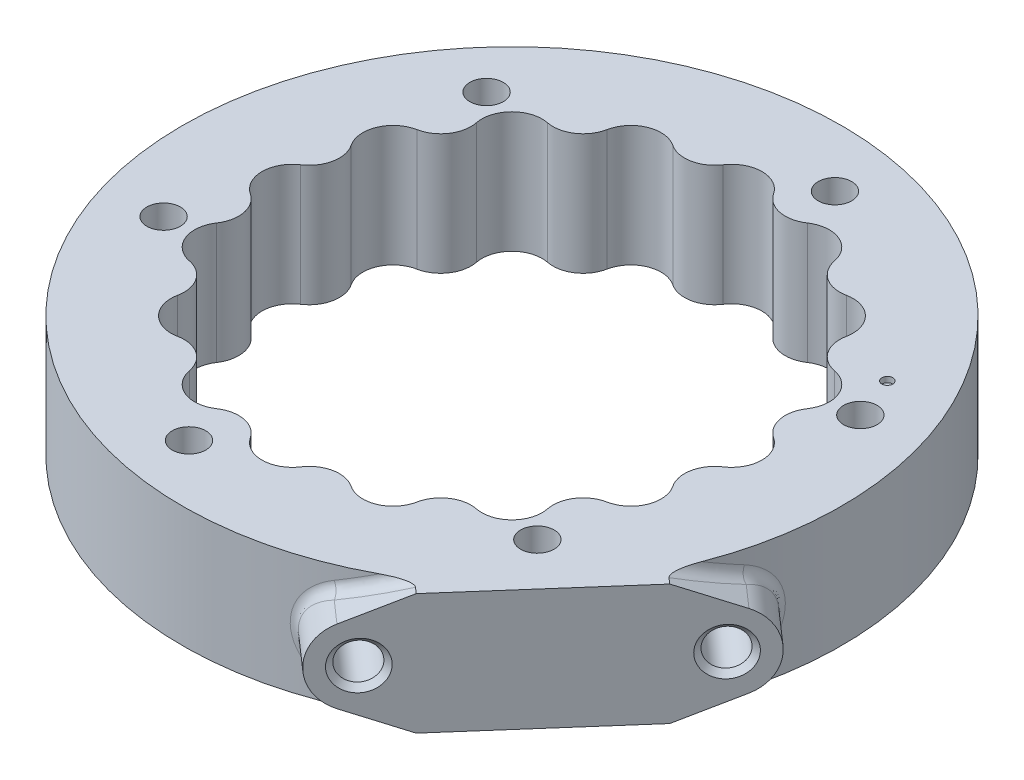
from build123d import *

# Parameters (mm, degrees)
SKETCH1_R                = 60
BOSS_EXTRUDE1_DEPTH      = 22
FILLET1_R                = 5
FILLET2_R                = 6
SKETCH3_R                = 3.05
CUT_EXTRUDE1_DEPTH       = 88.658428165
BOSS_EXTRUDE3_REACH      = 149.334
BOSS_EXTRUDE3_END_RADIUS = 60
SKETCH7_R                = 3.3
CUT_EXTRUDE3_DEPTH       = 10.5
CHAMFER2_SIZE            = 1
FILLET3_R                = 2
SKETCH8_W                = 32.70355213
SKETCH8_H                = 5.5
CUT_EXTRUDE4_DEPTH       = 149.347998989
SKETCH10_R               = 1
CUT_EXTRUDE6_DEPTH       = 1
CUT_EXTRUDE7_DEPTH       = 95.422690578


with BuildPart() as part:
    # Sketch1 → Boss-Extrude1 (new body)
    with BuildSketch(Plane(origin=(0, 0, 0), x_dir=(1, 0, 0), z_dir=(0, 1, 0))):
        with Locations(Location((0, 0, 0), (0, 0, 270))):
            Circle(SKETCH1_R)
        with BuildLine():
            ThreePointArc((-31.591922188, 24.534678569), (-33.258784492, 22.222809321), (-34.756792584, 19.798115295))
            ThreePointArc((-34.756792584, 19.798115295), (-41.574578963, 17.220754456), (-38.576145309, 10.577382149))
            ThreePointArc((-38.576145309, 10.577382149), (-39.231411216, 7.803612881), (-39.6875, 4.99022482))
            ThreePointArc((-39.6875, 4.99022482), (-45, 0), (-39.6875, -4.99022482))
            ThreePointArc((-39.6875, -4.99022482), (-39.231411216, -7.803612881), (-38.576145309, -10.577382149))
            ThreePointArc((-38.576145309, -10.577382149), (-41.574578963, -17.220754456), (-34.756792584, -19.798115295))
            ThreePointArc((-34.756792584, -19.798115295), (-33.258784492, -22.222809321), (-31.591922188, -24.534678569))
            ThreePointArc((-31.591922188, -24.534678569), (-31.819805153, -31.819805153), (-24.534678569, -31.591922188))
            ThreePointArc((-24.534678569, -31.591922188), (-22.222809321, -33.258784492), (-19.798115295, -34.756792584))
            ThreePointArc((-19.798115295, -34.756792584), (-17.220754456, -41.574578963), (-10.577382149, -38.576145309))
            ThreePointArc((-10.577382149, -38.576145309), (-7.803612881, -39.231411216), (-4.99022482, -39.6875))
            ThreePointArc((-4.99022482, -39.6875), (0, -45), (4.99022482, -39.6875))
            ThreePointArc((4.99022482, -39.6875), (7.803612881, -39.231411216), (10.577382149, -38.576145309))
            ThreePointArc((10.577382149, -38.576145309), (17.220754456, -41.574578963), (19.798115295, -34.756792584))
            ThreePointArc((19.798115295, -34.756792584), (22.222809321, -33.258784492), (24.534678569, -31.591922188))
            ThreePointArc((24.534678569, -31.591922188), (31.819805153, -31.819805153), (31.591922188, -24.534678569))
            ThreePointArc((31.591922188, -24.534678569), (33.258784492, -22.222809321), (34.756792584, -19.798115295))
            ThreePointArc((34.756792584, -19.798115295), (41.574578963, -17.220754456), (38.576145309, -10.577382149))
            ThreePointArc((38.576145309, -10.577382149), (39.231411216, -7.803612881), (39.6875, -4.99022482))
            ThreePointArc((39.6875, -4.99022482), (45, 0), (39.6875, 4.99022482))
            ThreePointArc((39.6875, 4.99022482), (39.231411216, 7.803612881), (38.576145309, 10.577382149))
            ThreePointArc((38.576145309, 10.577382149), (41.574578963, 17.220754456), (34.756792584, 19.798115295))
            ThreePointArc((34.756792584, 19.798115295), (33.258784492, 22.222809321), (31.591922188, 24.534678569))
            ThreePointArc((31.591922188, 24.534678569), (31.819805153, 31.819805153), (24.534678569, 31.591922188))
            ThreePointArc((24.534678569, 31.591922188), (22.222809321, 33.258784492), (19.798115295, 34.756792584))
            ThreePointArc((19.798115295, 34.756792584), (17.220754456, 41.574578963), (10.577382149, 38.576145309))
            ThreePointArc((10.577382149, 38.576145309), (7.803612881, 39.231411216), (4.99022482, 39.6875))
            ThreePointArc((4.99022482, 39.6875), (0, 45), (-4.99022482, 39.6875))
            ThreePointArc((-4.99022482, 39.6875), (-7.803612881, 39.231411216), (-10.577382149, 38.576145309))
            ThreePointArc((-10.577382149, 38.576145309), (-17.220754456, 41.574578963), (-19.798115295, 34.756792584))
            ThreePointArc((-19.798115295, 34.756792584), (-22.222809321, 33.258784492), (-24.534678569, 31.591922188))
            ThreePointArc((-24.534678569, 31.591922188), (-31.819805153, 31.819805153), (-31.591922188, 24.534678569))
        make_face(mode=Mode.SUBTRACT)
    extrude(amount=BOSS_EXTRUDE1_DEPTH)

    # Fillet1
    # the kernel refuses this fillet: 5 mm, written as the material it takes off along each edge
    with BuildSketch(Plane(origin=(-31.591922188, -7.937782114, -24.534678569), x_dir=(-0.5708127348451637, 0, -0.8210802772802334), z_dir=(0, 1, 0))) as fillet1_piece_1:
        with BuildLine():
            CenterArc((3.572001951, 4.856162203), FILLET1_R, 201.908932705, 54.314665287)
            ThreePointArc((-1.066888508, 2.990500041), (-0.503760138, 1.505840103), (0, 0))
            ThreePointArc((0, 0), (1.190667317, 0.143837797), (2.381334634, 0))
        make_face()
    extrude(amount=37.875564228, mode=Mode.SUBTRACT)
    with BuildSketch(Plane(origin=(-34.756792584, -7.937782114, -19.798115295), x_dir=(-0.977019839336146, 0, -0.21314838386338178), z_dir=(0, 1, 0)), Plane(origin=(10.577382149, -7.937782114, 38.576145309), x_dir=(0.5401386861196337, 0, 0.8415760213771278), z_dir=(0, 1, 0)), Plane(origin=(-4.99022482, -7.937782114, 39.6875), x_dir=(0.176965876366712, 0, 0.984216987560041), z_dir=(0, 1, 0)), Plane(origin=(-19.798115295, -7.937782114, 34.756792584), x_dir=(-0.21314838386337953, 0, 0.9770198393361466), z_dir=(0, 1, 0)), Plane(origin=(-31.591922188, -7.937782114, 24.534678569), x_dir=(-0.5708127348451787, 0, 0.8210802772802229), z_dir=(0, 1, 0)), Plane(origin=(-38.576145309, -7.937782114, 10.577382149), x_dir=(-0.84157602137713, 0, 0.5401386861196305), z_dir=(0, 1, 0)), Plane(origin=(-39.6875, -7.937782114, -4.99022482), x_dir=(-0.9842169875600411, 0, 0.17696587636671054), z_dir=(0, 1, 0)), Plane(origin=(24.534678569, -7.937782114, 31.591922188), x_dir=(0.8210802772802258, 0, 0.5708127348451744), z_dir=(0, 1, 0)), Plane(origin=(34.756792584, -7.937782114, 19.798115295), x_dir=(0.9770198393361469, 0, 0.2131483838633775), z_dir=(0, 1, 0)), Plane(origin=(39.6875, -7.937782114, 4.99022482), x_dir=(0.9842169875600401, 0, -0.1769658763667165), z_dir=(0, 1, 0)), Plane(origin=(38.576145309, -7.937782114, -10.577382149), x_dir=(0.8415760213771245, 0, -0.5401386861196388), z_dir=(0, 1, 0)), Plane(origin=(31.591922188, -7.937782114, -24.534678569), x_dir=(0.5708127348451758, 0, -0.8210802772802248), z_dir=(0, 1, 0)), Plane(origin=(19.798115295, -7.937782114, -34.756792584), x_dir=(0.21314838386337198, 0, -0.9770198393361482), z_dir=(0, 1, 0)), Plane(origin=(4.99022482, -7.937782114, -39.6875), x_dir=(-0.17696587636672031, 0, -0.9842169875600394), z_dir=(0, 1, 0)), Plane(origin=(-10.577382149, -7.937782114, -38.576145309), x_dir=(-0.5401386861196261, 0, -0.8415760213771326), z_dir=(0, 1, 0)), Plane(origin=(-24.534678569, -7.937782114, -31.591922188), x_dir=(-0.82108027728022, 0, -0.5708127348451829), z_dir=(0, 1, 0))) as fillet1_piece_2:
        with BuildLine():
            CenterArc((3.572001951, -4.856162203), FILLET1_R, 103.776402008, 54.314665287)
            ThreePointArc((-1.066888508, -2.990500041), (-0.503760138, -1.505840103), (0, 0))
            ThreePointArc((0, 0), (1.190667317, -0.143837797), (2.381334634, 0))
        make_face()
    extrude(amount=37.875564228, mode=Mode.SUBTRACT)
    with BuildSketch(Plane(origin=(4.99022482, -7.937782114, 39.6875), x_dir=(0.9864543257067245, 0, -0.1640361645933343), z_dir=(0, 1, 0)), Plane(origin=(-10.577382149, -7.937782114, 38.576145309), x_dir=(0.9741388837762464, 0, 0.22595007217340898), z_dir=(0, 1, 0)), Plane(origin=(-24.534678569, -7.937782114, 31.591922188), x_dir=(0.8135196273818055, 0, 0.5815374586942516), z_dir=(0, 1, 0)), Plane(origin=(-34.756792584, -7.937782114, 19.798115295), x_dir=(0.5290493822922732, 0, 0.8485910387790836), z_dir=(0, 1, 0)), Plane(origin=(-39.6875, -7.937782114, 4.99022482), x_dir=(0.1640361645933272, 0, 0.9864543257067256), z_dir=(0, 1, 0)), Plane(origin=(-38.576145309, -7.937782114, -10.577382149), x_dir=(-0.22595007217340937, 0, 0.9741388837762464), z_dir=(0, 1, 0)), Plane(origin=(19.798115295, -7.937782114, 34.756792584), x_dir=(0.8485910387790846, 0, -0.5290493822922715), z_dir=(0, 1, 0)), Plane(origin=(31.591922188, -7.937782114, 24.534678569), x_dir=(0.5815374586942491, 0, -0.8135196273818073), z_dir=(0, 1, 0)), Plane(origin=(38.576145309, -7.937782114, 10.577382149), x_dir=(0.22595007217340277, 0, -0.9741388837762479), z_dir=(0, 1, 0)), Plane(origin=(39.6875, -7.937782114, -4.99022482), x_dir=(-0.16403616459333684, 0, -0.9864543257067241), z_dir=(0, 1, 0)), Plane(origin=(34.756792584, -7.937782114, -19.798115295), x_dir=(-0.5290493822922758, 0, -0.8485910387790819), z_dir=(0, 1, 0)), Plane(origin=(24.534678569, -7.937782114, -31.591922188), x_dir=(-0.8135196273818096, 0, -0.5815374586942458), z_dir=(0, 1, 0)), Plane(origin=(10.577382149, -7.937782114, -38.576145309), x_dir=(-0.9741388837762485, 0, -0.22595007217340046), z_dir=(0, 1, 0)), Plane(origin=(-4.99022482, -7.937782114, -39.6875), x_dir=(-0.9864543257067236, 0, 0.16403616459333964), z_dir=(0, 1, 0)), Plane(origin=(-19.798115295, -7.937782114, -34.756792584), x_dir=(-0.8485910387790874, 0, 0.5290493822922673), z_dir=(0, 1, 0))) as fillet1_piece_3:
        with BuildLine():
            CenterArc((3.373557398, -4.996060424), FILLET1_R, 92.274604499, 54.314665287)
            ThreePointArc((-0.800166381, -2.24287503), (-0.264608655, -1.169769307), (0, 0))
            ThreePointArc((0, 0), (1.587556423, -0.031516609), (3.175112846, 0))
        make_face()
    extrude(amount=37.875564228, mode=Mode.SUBTRACT)

    # Fillet2
    fillet2_edges = [part.edges().sort_by_distance(p)[0] for p in [
        (-7.805937782, 11, 39.243099283),
        (7.805937782, 11, 39.243099283),
        (22.229430079, 11, 33.268693157),
        (33.268693157, 11, 22.229430079),
        (-22.229430079, 11, 33.268693157),
        (-33.268693157, 11, 22.229430079),
        (-39.243099283, 11, 7.805937782),
        (-39.243099283, 11, -7.805937782),
        (39.243099283, 11, 7.805937782),
        (39.243099283, 11, -7.805937782),
        (33.268693157, 11, -22.229430079),
        (22.229430079, 11, -33.268693157),
        (7.805937782, 11, -39.243099283),
        (-7.805937782, 11, -39.243099283),
        (-22.229430079, 11, -33.268693157),
        (-33.268693157, 11, -22.229430079),
    ]]
    fillet(fillet2_edges, radius=FILLET2_R)

    # Sketch3 → Cut-Extrude1 (cut, through all)
    with BuildSketch(Plane(origin=(0, 22, 0), x_dir=(1, 0, 0), z_dir=(0, 1, 0))):
        with Locations(Location((9.754516101, 49.03926402, 0), (0, 0, 270))):
            Circle(SKETCH3_R)
        with Locations(Location((47.346506475, 16.071973265, 0), (0, 0, 270))):
            Circle(SKETCH3_R)
        with Locations(Location((37.591990374, -32.967290755, 0), (0, 0, 270))):
            Circle(SKETCH3_R)
        with Locations(Location((-9.754516101, -49.03926402, 0), (0, 0, 270))):
            Circle(SKETCH3_R)
        with Locations(Location((-47.346506475, -16.071973265, 0), (0, 0, 270))):
            Circle(SKETCH3_R)
        with Locations(Location((-37.591990374, 32.967290755, 0), (0, 0, 270))):
            Circle(SKETCH3_R)
    extrude(amount=-CUT_EXTRUDE1_DEPTH, mode=Mode.SUBTRACT)

    # Boss-Extrude3: up to this cylinder (the profile starts outside it)
    boss_extrude3_end = Plane(origin=(0, 11, 0), z_dir=(0, -1, 0)) * Cylinder(BOSS_EXTRUDE3_END_RADIUS, 419.668, mode=Mode.PRIVATE)
    # Sketch6 → Boss-Extrude3 (add, up to the surface)
    with BuildSketch(Plane(origin=(48.322940338, 0, 37.41419036), x_dir=(-0.6593458151000848, 0, 0.7518398074789634), z_dir=(-0.7518398074789634, 0, -0.6593458151000848)), mode=Mode.PRIVATE) as boss_extrude3_sk1:
        with BuildLine():
            Line((-22.841633403, 17.677522556), (-2.694264982, 26.197120299))
            ThreePointArc((-2.694264982, 26.197120299), (3.732050808, 27.5), (10.158366597, 26.197120299))
            Line((10.158366597, 26.197120299), (30.305735018, 17.677522556))
            ThreePointArc((30.305735018, 17.677522556), (34.732050808, 11), (30.305735018, 4.322477444))
            Line((30.305735018, 4.322477444), (10.158366597, -4.197120299))
            ThreePointArc((10.158366597, -4.197120299), (3.732050808, -5.5), (-2.694264982, -4.197120299))
            Line((-2.694264982, -4.197120299), (-22.841633403, 4.322477444))
            ThreePointArc((-22.841633403, 4.322477444), (-27.267949192, 11), (-22.841633403, 17.677522556))
        make_face()
    boss_extrude3_tool1 = extrude(boss_extrude3_sk1.sketch, amount=BOSS_EXTRUDE3_REACH, mode=Mode.PRIVATE) - boss_extrude3_end
    add(boss_extrude3_tool1.solids().sort_by_distance((45.862228, 11, 40.220095))[0])

    # Sketch7 → Cut-Extrude3 (cut)
    with BuildSketch(Plane(origin=(45.862228256, 0, 40.220094721), x_dir=(0.6593458151000849, 0, -0.7518398074789633), z_dir=(0.7518398074789633, 0, 0.6593458151000849))):
        with Locations((23.75, 11)):
            Circle(SKETCH7_R)
        with Locations((-23.75, 11)):
            Circle(SKETCH7_R)
    extrude(amount=-CUT_EXTRUDE3_DEPTH, mode=Mode.SUBTRACT)

    # Chamfer2
    chamfer2_edges = [part.edges().sort_by_distance(p)[0] for p in [
        (59.345850175, 11, 24.844970658),
        (28.026923958, 11, 60.557361513),
    ]]
    chamfer(chamfer2_edges, length=CHAMFER2_SIZE)

    # Fillet3
    fillet3_edges = [part.edges().sort_by_distance(p)[0] for p in [
        (56.305748885, 19.805835114, 20.728305345),
        (27.900346821, 2.194164886, 53.11845863),
        (59.062632001, 11, 10.564350485),
        (56.305748885, 2.194164886, 20.728305345),
        (18.18319146, 11, 57.178418554),
        (27.900346821, 19.805835114, 53.11845863),
    ]]
    fillet(fillet3_edges, radius=FILLET3_R)

    # Sketch8 → Cut-Extrude4 (cut, through all)
    with BuildSketch(Plane(origin=(45.862228256, 0, 40.220094721), x_dir=(0.6593458151000848, 0, -0.7518398074789634), z_dir=(0.7518398074789634, 0, 0.6593458151000848))):
        with Locations((0, 24.75)):
            Rectangle(SKETCH8_W, SKETCH8_H)
        with Locations((0, -2.75)):
            Rectangle(SKETCH8_W, SKETCH8_H)
    extrude(amount=-CUT_EXTRUDE4_DEPTH, mode=Mode.SUBTRACT)

    # Sketch10 → Cut-Extrude6 (cut)
    with BuildSketch(Plane(origin=(0, 22, 0), x_dir=(1, 0, 0), z_dir=(0, 1, 0))):
        with Locations(Location((44.425227151, 23.905313753, 0), (0, 0, 270))):
            Circle(SKETCH10_R)
    extrude(amount=-CUT_EXTRUDE6_DEPTH, mode=Mode.SUBTRACT)

    # Sketch11 → Cut-Extrude7 (cut, through all)
    with BuildSketch(Plane(origin=(0, 22, 0), x_dir=(1, 0, 0), z_dir=(0, 1, 0))):
        with BuildLine():
            ThreePointArc((-43.040639218, 4.583068093), (-45.5, 0), (-43.040639218, -4.583068093))
            ThreePointArc((-43.040639218, -4.583068093), (-40.686959394, -8.093139415), (-41.518229869, -12.23673674))
            ThreePointArc((-41.518229869, -12.23673674), (-42.036518729, -17.412096173), (-38.010501411, -20.705142354))
            ThreePointArc((-38.010501411, -20.705142354), (-34.492738655, -23.047311133), (-33.675046385, -27.193609331))
            ThreePointArc((-33.675046385, -27.193609331), (-32.173358544, -32.173358544), (-27.193609331, -33.675046385))
            ThreePointArc((-27.193609331, -33.675046385), (-23.047311133, -34.492738655), (-20.705142354, -38.010501411))
            ThreePointArc((-20.705142354, -38.010501411), (-17.412096173, -42.036518729), (-12.23673674, -41.518229869))
            ThreePointArc((-12.23673674, -41.518229869), (-8.093139415, -40.686959394), (-4.583068093, -43.040639218))
            ThreePointArc((-4.583068093, -43.040639218), (0, -45.5), (4.583068093, -43.040639218))
            ThreePointArc((4.583068093, -43.040639218), (8.093139415, -40.686959394), (12.23673674, -41.518229869))
            ThreePointArc((12.23673674, -41.518229869), (17.412096173, -42.036518729), (20.705142354, -38.010501411))
            ThreePointArc((20.705142354, -38.010501411), (23.047311133, -34.492738655), (27.193609331, -33.675046385))
            ThreePointArc((27.193609331, -33.675046385), (32.173358544, -32.173358544), (33.675046385, -27.193609331))
            ThreePointArc((33.675046385, -27.193609331), (34.492738655, -23.047311133), (38.010501411, -20.705142354))
            ThreePointArc((38.010501411, -20.705142354), (42.036518729, -17.412096173), (41.518229869, -12.23673674))
            ThreePointArc((41.518229869, -12.23673674), (40.686959394, -8.093139415), (43.040639218, -4.583068093))
            ThreePointArc((43.040639218, -4.583068093), (45.5, 0), (43.040639218, 4.583068093))
            ThreePointArc((43.040639218, 4.583068093), (40.686959394, 8.093139415), (41.518229869, 12.23673674))
            ThreePointArc((41.518229869, 12.23673674), (42.036518729, 17.412096173), (38.010501411, 20.705142354))
            ThreePointArc((38.010501411, 20.705142354), (34.492738655, 23.047311133), (33.675046385, 27.193609331))
            ThreePointArc((33.675046385, 27.193609331), (32.173358544, 32.173358544), (27.193609331, 33.675046385))
            ThreePointArc((27.193609331, 33.675046385), (23.047311133, 34.492738655), (20.705142354, 38.010501411))
            ThreePointArc((20.705142354, 38.010501411), (17.412096173, 42.036518729), (12.23673674, 41.518229869))
            ThreePointArc((12.23673674, 41.518229869), (8.093139415, 40.686959394), (4.583068093, 43.040639218))
            ThreePointArc((4.583068093, 43.040639218), (0, 45.5), (-4.583068093, 43.040639218))
            ThreePointArc((-4.583068093, 43.040639218), (-8.093139415, 40.686959394), (-12.23673674, 41.518229869))
            ThreePointArc((-12.23673674, 41.518229869), (-17.412096173, 42.036518729), (-20.705142354, 38.010501411))
            ThreePointArc((-20.705142354, 38.010501411), (-23.047311133, 34.492738655), (-27.193609331, 33.675046385))
            ThreePointArc((-27.193609331, 33.675046385), (-32.173358544, 32.173358544), (-33.675046385, 27.193609331))
            ThreePointArc((-33.675046385, 27.193609331), (-34.492738655, 23.047311133), (-38.010501411, 20.705142354))
            ThreePointArc((-38.010501411, 20.705142354), (-42.036518729, 17.412096173), (-41.518229869, 12.23673674))
            ThreePointArc((-41.518229869, 12.23673674), (-40.686959394, 8.093139415), (-43.040639218, 4.583068093))
        make_face()
    extrude(amount=-CUT_EXTRUDE7_DEPTH, mode=Mode.SUBTRACT)


solid = part.part
